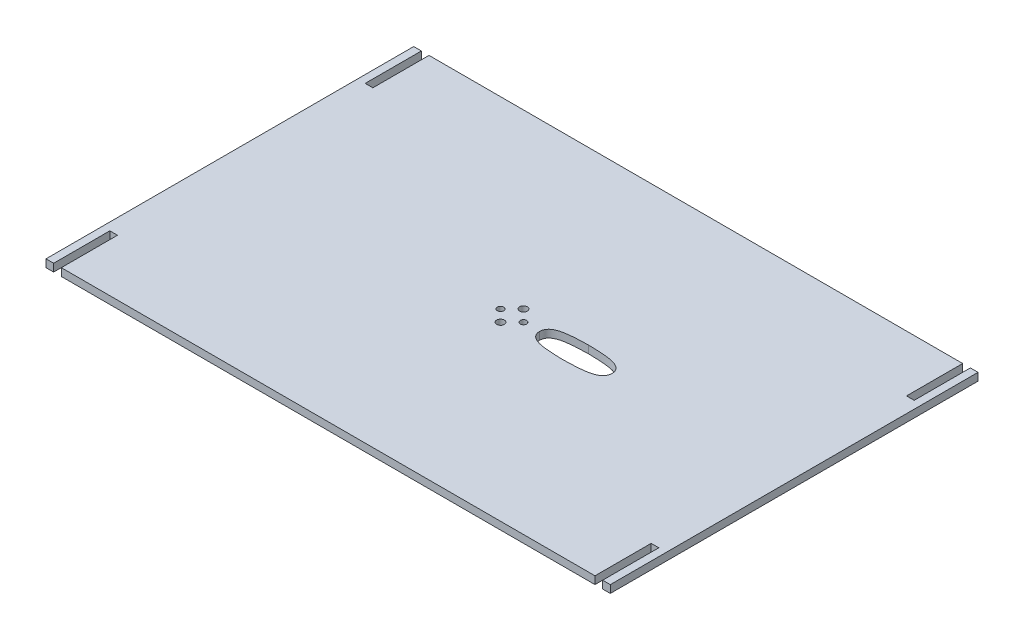
from build123d import *

# Parameters (mm, degrees)
BOSS_EXTRUDE1_DEPTH = 6
SKETCH2_R           = 3
SKETCH2_R_2         = 2.5
CUT_EXTRUDE1_DEPTH  = 6


with BuildPart() as part:
    # Sketch1 → Boss-Extrude1 (new body)
    with BuildSketch(Plane(origin=(0, 0, 0), x_dir=(1, 0, 0), z_dir=(0, 1, 0))):
        Polygon((418, 244), (424, 244), (424, 288), (430, 288), (430, 0), (424, 0), (424, 44), (418, 44), (418, 0), (0, 0), (0, 44), (-6, 44), (-6, 0), (-12, 0), (-12, 288), (-6, 288), (-6, 244), (0, 244), (0, 288), (418, 288), align=None)
    extrude(amount=BOSS_EXTRUDE1_DEPTH)

    # Sketch2 → Cut-Extrude1 (cut)
    with BuildSketch(Plane(origin=(0, 6, 0), x_dir=(1, 0, 0), z_dir=(0, 1, 0))):
        with Locations((209, 135)):
            Circle(SKETCH2_R)
        with Locations((209, 153)):
            Circle(SKETCH2_R)
        with Locations((200, 144)):
            Circle(SKETCH2_R_2)
        with Locations((218, 144)):
            Circle(SKETCH2_R_2)
        with BuildLine():
            add(Edge.make_bspline(
                [(259, 154), (240.978482396, 153.666282679), (230.933324248, 152.446887217), (230.5, 144)],
                knots=[0, 0, 0, 0, 1, 1, 1, 1], degree=3))
            add(Edge.make_bspline(
                [(259, 134), (240.978482396, 134.333717321), (230.933324248, 135.553112783), (230.5, 144)],
                knots=[0, 0, 0, 0, 1, 1, 1, 1], degree=3))
            add(Edge.make_bspline(
                [(259, 134), (277.021517604, 134.333717321), (287.066675752, 135.553112783), (287.5, 144)],
                knots=[0, 0, 0, 0, 1, 1, 1, 1], degree=3))
            add(Edge.make_bspline(
                [(259, 154), (277.021517604, 153.666282679), (287.066675752, 152.446887217), (287.5, 144)],
                knots=[0, 0, 0, 0, 1, 1, 1, 1], degree=3))
        make_face()
    extrude(amount=-CUT_EXTRUDE1_DEPTH, mode=Mode.SUBTRACT)


solid = part.part
